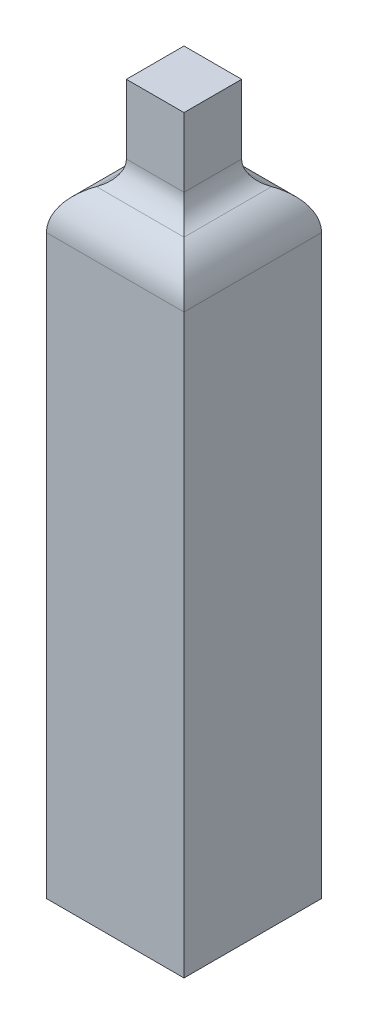
from build123d import *

# Parameters (mm, degrees)
SKETCH1_W           = 15.5
SKETCH1_H           = 15.5
BOSS_EXTRUDE1_DEPTH = 70
SKETCH2_W           = 6.5
SKETCH2_H           = 6.5
BOSS_EXTRUDE2_DEPTH = 10
FILLET1_R           = 5
FILLET2_R           = 3


with BuildPart() as part:
    # Sketch1 → Boss-Extrude1 (new body)
    with BuildSketch(Plane(origin=(0, 0, 0), x_dir=(1, 0, 0), z_dir=(0, 1, 0))):
        Rectangle(SKETCH1_W, SKETCH1_H)
    extrude(amount=BOSS_EXTRUDE1_DEPTH)

    # Sketch2 → Boss-Extrude2 (add)
    with BuildSketch(Plane(origin=(0, 70, 0), x_dir=(1, 0, 0), z_dir=(0, 1, 0))):
        Rectangle(SKETCH2_W, SKETCH2_H)
    extrude(amount=BOSS_EXTRUDE2_DEPTH)

    # Fillet1
    # the kernel refuses this fillet: 5 mm, written as the material it takes off along each edge
    with BuildSketch(Plane(origin=(-7.75, 70, 20.187342964), x_dir=(0, -1, 0), z_dir=(0, 0, -1)), Plane(origin=(7.75, 70, -20.187342964), x_dir=(0, -1, 0), z_dir=(0, 0, 1)), Plane(origin=(-20.187342964, 70, -7.75), x_dir=(0, -1, 0), z_dir=(1, 0, 0))) as fillet1_piece_1:
        with BuildLine():
            CenterArc((4.974937186, -5), FILLET1_R, 90, 84.260829523)
            Line((0, -4.5), (-0.099498744, -4.49))
            ThreePointArc((-0.099498744, -4.49), (-0.1, -2.25), (-0.1, 0))
            Line((-0.1, 0), (0, 0.1))
            Line((0, 0.1), (4.974937186, 0.1))
            Line((4.974937186, 0.1), (4.974937186, 0))
        make_face()
    extrude(amount=40.374685928, mode=Mode.SUBTRACT)
    with BuildSketch(Plane(origin=(20.187342964, 70, 7.75), x_dir=(0, 0, -1), z_dir=(-1, 0, 0))) as fillet1_piece_2:
        with BuildLine():
            CenterArc((5, 4.974937186), FILLET1_R, 180, 84.260829523)
            Line((0, 4.974937186), (-0.1, 4.974937186))
            Line((-0.1, 4.974937186), (-0.1, 0))
            Line((-0.1, 0), (0, -0.1))
            ThreePointArc((0, -0.1), (2.25, -0.1), (4.49, -0.099498744))
            Line((4.49, -0.099498744), (4.5, 0))
        make_face()
    extrude(amount=40.374685928, mode=Mode.SUBTRACT)

    # Fillet2
    fillet2_edges = [part.edges().sort_by_distance(p)[0] for p in [
        (-3.25, 70, 0),
        (0, 70, -3.25),
        (0, 70, 3.25),
        (3.25, 70, 0),
    ]]
    fillet(fillet2_edges, radius=FILLET2_R)


solid = part.part
